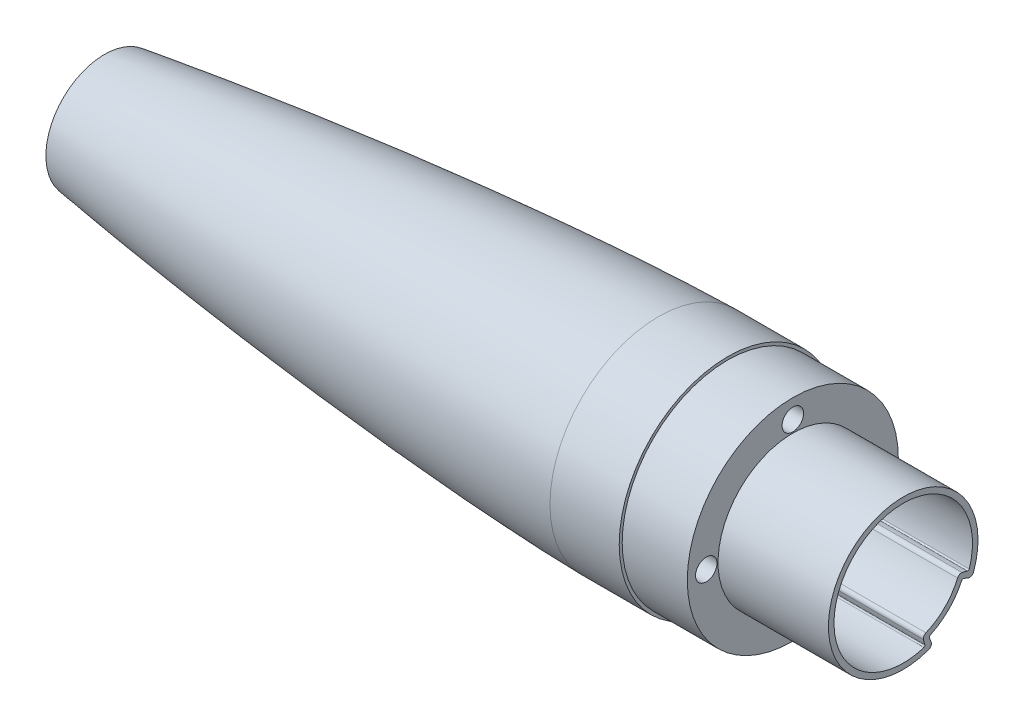
from build123d import *

# Parameters (mm, degrees)
CUT_EXTRUDE1_DEPTH = 400
SKETCH3_R          = 33
SKETCH3_R_2        = 3.1000000000000028
CUT_EXTRUDE2_DEPTH = 40
SKETCH3_2_R        = 3.1000000000000028
CUT_EXTRUDE4_DEPTH = 588.2704126987336
SKETCH4_R          = 7.750000000000002
SKETCH4_R_2        = 7.749999999999998
SKETCH4_R_3        = 7.75
CUT_EXTRUDE5_DEPTH = 30
CUT_EXTRUDE6_START = -166.72
CUT_EXTRUDE6_DEPTH = 166.72
CUT_EXTRUDE7_START = -166.72
CUT_EXTRUDE7_DEPTH = 40
FILLET1_R          = 3
FILLET2_R          = 1


# Read off the part's stored shape, not the designer's step: Cut-Extrude7
with BuildPart() as part:
    # Sketch1 → Revolve1 (revolve)
    with BuildSketch(Plane.XY, mode=Mode.PRIVATE) as revolve1_sk:
        with BuildLine():
            Line((650.0000000000001, 78.36), (600.0000000000001, 78.35999999999999))
            add(Edge.make_bspline(
                [(200.00000000000358, 42.32828037010144), (208.17052038042252, 43.51395402277683), (225.68488706430128, 45.99527814756255), (252.5646252490451, 49.61720291886234), (288.8377795121088, 54.154525537406215), (326.32073414086074, 58.489281573967666), (363.84117713275197, 62.4863121261995), (401.3959942076804, 66.1465092198773), (438.98297125108434, 69.46060873551288), (476.60065297069735, 72.40710938265987), (509.54226569024473, 74.62869781075653), (537.7964811389767, 76.23350465282824), (560.2922621801154, 77.27545940077594), (575.1953567037801, 77.83264328043563), (587.2142250450652, 78.17300672656529), (594.5199761893905, 78.31035588184413), (598.173256760109, 78.35432466011183), (600.0000000000001, 78.35999999999999)],
                knots=[0.33782774337518406, 0.33782774337518406, 0.33782774337518406, 0.33782774337518406, 0.33782774337518406, 0.3922467059008778, 0.45442341660838875, 0.5166001272068571, 0.5787768404127641, 0.6409535517353824, 0.7031302632972144, 0.7653069754242735, 0.8274836869805778, 0.8896603985814769, 0.9207487548355946, 0.9518371110897123, 0.9759185555448562, 0.9879592777724281, 1, 1, 1, 1, 1], degree=4))
            Line((200.0000000000036, 42.32828037010143), (200, -7.43e-14))
            Line((200, 0), (776.72, 0))
            Line((776.72, 0), (776.72, 54))
            Line((776.72, 54), (697.0000000000002, 54))
            Line((697.0000000000002, 54), (697.0000000000002, 76.20000000000005))
            Line((697.0000000000002, 76.20000000000005), (650.0000000000001, 76.20000000000005))
            Line((650.0000000000001, 76.20000000000005), (650.0000000000001, 78.36))
        make_face()
    revolve(revolve1_sk.sketch.rotate(Axis((776.72, 0, 0), (-1, 0, 0)), 90), axis=Axis((776.72, 0, 0), (-1, 0, 0)))

    # Sketch2 → Cut-Extrude1 (cut)
    with BuildSketch(Plane(origin=(776.72, 0, 0), x_dir=(0, 0, -1), z_dir=(1, 0, 0))):
        with BuildLine():
            ThreePointArc((47.36738574096539, -16.010333165383813), (-35.35533905932756, 35.35533905932719), (16.01033316538431, -47.367385740965226))
            ThreePointArc((16.010333165384957, -47.36738574096489), (14.843408327061695, -43.77194076139418), (14.25549204864172, -40.03786890496388))
            ThreePointArc((14.25549204864269, -40.03786890496403), (30.05203820042843, -30.05203820042811), (40.037868904964185, -14.255492048642266))
            ThreePointArc((40.03786890496402, -14.255492048641287), (43.77194076139434, -14.843408327061226), (47.36738574096508, -16.01033316538445))
        make_face()
    extrude(amount=-CUT_EXTRUDE1_DEPTH, mode=Mode.SUBTRACT)

    # Sketch3 → Cut-Extrude2 (cut)
    with BuildSketch(Plane.ZY.offset(-200.00000000000273)):
        Circle(SKETCH3_R)
        with Locations((0, 20)):
            Circle(SKETCH3_R_2, mode=Mode.SUBTRACT)
        with Locations((0, -20)):
            Circle(SKETCH3_R_2, mode=Mode.SUBTRACT)
    extrude(amount=-CUT_EXTRUDE2_DEPTH, mode=Mode.SUBTRACT)

    # Sketch3<2> → Cut-Extrude4 (cut, through all)
    with BuildSketch(Plane.ZY.offset(-200.00000000000273)):
        with Locations((0, 20)):
            Circle(SKETCH3_2_R)
        with Locations((0, -20)):
            Circle(SKETCH3_2_R)
    extrude(amount=-CUT_EXTRUDE4_DEPTH, mode=Mode.SUBTRACT)

    # Sketch4 → Cut-Extrude5 (cut)
    with BuildSketch(Plane(origin=(697.0000000000002, 0, 0), x_dir=(0, 0, -1), z_dir=(1, 0, 0))):
        with Locations((0, 62.5)):
            Circle(SKETCH4_R)
        with Locations((62.499999999999986, -2.1825e-13)):
            Circle(SKETCH4_R_2)
        with Locations((-4.3715e-13, -62.5)):
            Circle(SKETCH4_R_3)
        with Locations((-62.49999999999999, 6.5573e-13)):
            Circle(SKETCH4_R_2)
    extrude(amount=-CUT_EXTRUDE5_DEPTH, mode=Mode.SUBTRACT)

    # Sketch2<3> → Cut-Extrude6 (cut)
    with BuildSketch(Plane(origin=(776.72, 0, 0), x_dir=(0, 0, -1), z_dir=(1, 0, 0)).offset(CUT_EXTRUDE6_START)):
        with BuildLine():
            ThreePointArc((18.674162122276517, -42.585510083018875), (19.845504593214095, -46.16550545726443), (21.667324002424465, -49.462380356933224))
            ThreePointArc((21.66732400242451, -49.46238035693348), (38.18376618407376, -38.18376618407337), (49.4623803569337, -21.667324002424003))
            ThreePointArc((49.46238035693346, -21.667324002423932), (46.16550545726464, -19.845504593213597), (42.58551008301907, -18.67416212227606))
            ThreePointArc((42.58551008301935, -18.674162122276265), (32.880465325174626, -32.88046532517429), (18.674162122276698, -42.58551008301916))
        make_face()
    extrude(amount=CUT_EXTRUDE6_DEPTH, mode=Mode.SUBTRACT)

    # Cut-Extrude7 outline → Cut-Extrude7 (cut)
    with BuildSketch(Plane(origin=(776.72, 0, 0), x_dir=(0, 0, -1), z_dir=(1, 0, 0)).offset(CUT_EXTRUDE7_START)):
        with BuildLine():
            ThreePointArc((49.462380357, -21.667324002), (38.183766184, -38.183766184), (21.667324002, -49.462380357))
            ThreePointArc((21.667324002, -49.462380357), (52.325901808, -52.325901808), (49.462380357, -21.667324002))
        make_face()
    extrude(amount=CUT_EXTRUDE7_DEPTH, mode=Mode.SUBTRACT)

    # Fillet1
    # the kernel refuses this fillet: 3 mm, written as the material it takes off along each edge
    with BuildSketch(Plane(origin=(783.0040750376627, -40.03786890496436, -14.255492048641756), x_dir=(0, 0.36048933664361255, -0.9327633344885766), z_dir=(-1, 0, 0))) as fillet1_piece_1:
        with BuildLine():
            CenterArc((2.3526530908588352, 2.998927692547355), FILLET1_R, 190.6958961912189, 77.77213613267259)
            ThreePointArc((-0.5952251863106816, 2.4421389866704493), (-0.3296065941102598, 1.2132715607510574), (0, 0))
            ThreePointArc((0, 0), (1.1362245041079626, 0.01519102224578455), (2.2724490082159248, 3e-17))
        make_face()
    extrude(amount=406.28407503766266, mode=Mode.SUBTRACT)
    with BuildSketch(Plane(origin=(783.0040750376628, -14.255492048641326, -40.03786890496452), x_dir=(0, -0.12935906708338796, -0.9915978175466682), z_dir=(-1, 0, 0))) as fillet1_piece_2:
        with BuildLine():
            CenterArc((2.356528139123201, 2.995883676075499), FILLET1_R, 195.22966173823434, 77.77213613267247)
            ThreePointArc((-0.5381137542877349, 2.207817492997983), (-0.25429790806270375, 1.1075059660548925), (0, 0))
            ThreePointArc((0, 0), (1.2568150075323716, -0.0329305913960081), (2.513630015064742, 0))
        make_face()
    extrude(amount=406.2840750376628, mode=Mode.SUBTRACT)
    with BuildSketch(Plane(origin=(697.0000000000002, -49.46238035693335, -21.667324002424486), x_dir=(0, -0.3710376913926641, 0.9286178070476584), z_dir=(1, 0, 0))) as fillet1_piece_3:
        with BuildLine():
            CenterArc((3.4382745469761065, -2.998391169718282), FILLET1_R, 88.12348720794618, 95.23374468145443)
            ThreePointArc((0.4434230907932443, -3.1740748496643687), (0.2853925875390597, -1.5781410862550613), (0, 0))
            ThreePointArc((0, 0), (1.7682554813020526, 0.0289589450709421), (3.5365109626041082, -1.1e-16))
        make_face()
    extrude(amount=88.56127740651004, mode=Mode.SUBTRACT)
    with BuildSketch(Plane(origin=(697.0000000000002, -21.667324002423964, -49.46238035693357), x_dir=(0, 0.9286178070476617, -0.3710376913926558), z_dir=(1, 0, 0))) as fillet1_piece_4:
        with BuildLine():
            CenterArc((3.438274546976126, 2.998391169718279), FILLET1_R, 176.64276811059946, 95.23374468145443)
            ThreePointArc((0.44342309079326614, 3.174074849664362), (0.28539258753907326, 1.5781410862550511), (0, 0))
            ThreePointArc((0, 0), (1.7682554813020637, -0.02895894507093817), (3.53651096260413, 5e-17))
        make_face()
    extrude(amount=88.56127740651004, mode=Mode.SUBTRACT)

    # Fillet2
    fillet2_edges = [part.edges().sort_by_distance(p)[0] for p in [
        (576.72, -47.36738574096506, -16.010333165384637),
        (576.72, -16.01033316538413, -47.36738574096523),
        (693.36, -18.67416212227616, -42.58551008301921),
        (693.36, -42.58551008301902, -18.674162122276606),
    ]]
    fillet(fillet2_edges, radius=FILLET2_R)


solid = part.part
